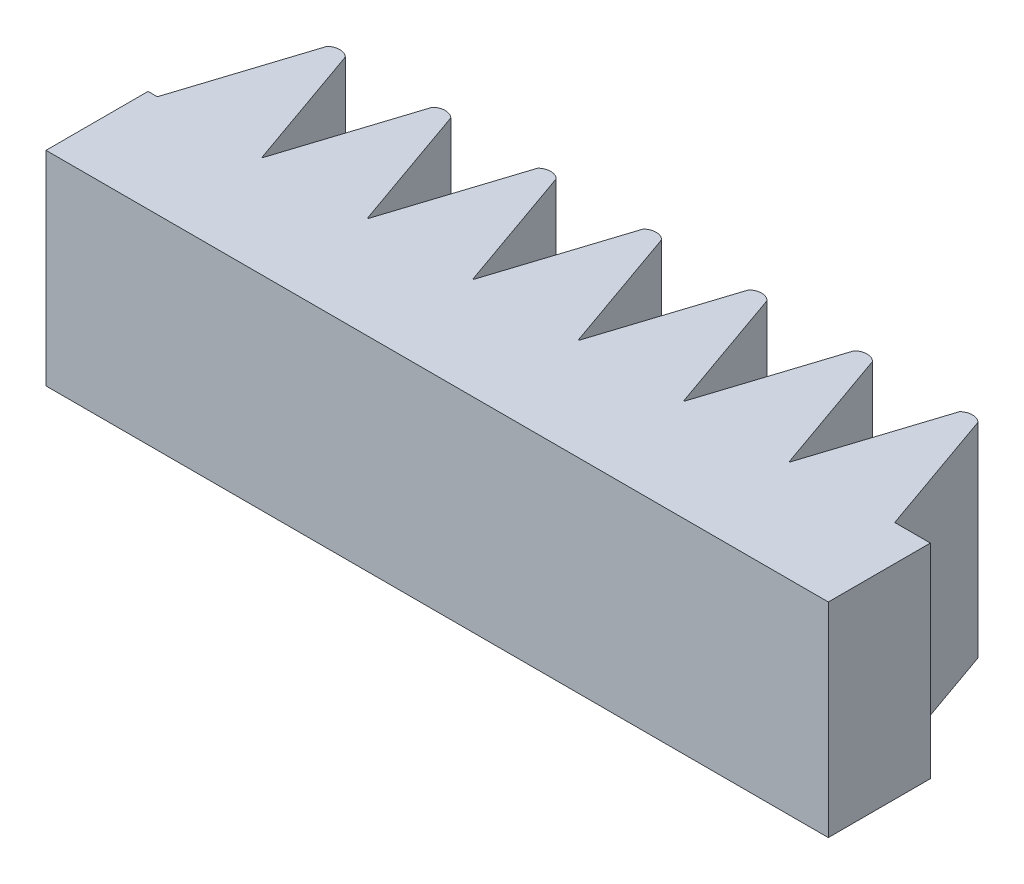
from build123d import *

# Parameters (mm, degrees)
BOSS_EXTRUDE1_DEPTH   = 6
BOSS_EXTRUDE1_2_DEPTH = 6
BOSS_EXTRUDE1_3_DEPTH = 6
BOSS_EXTRUDE1_4_DEPTH = 6
BOSS_EXTRUDE1_5_DEPTH = 6
BOSS_EXTRUDE1_6_DEPTH = 6
BOSS_EXTRUDE1_7_DEPTH = 6
BASE_W                = 23
BASE_H                = 3
BOSS_EXTRUDE2_DEPTH   = 6


with BuildPart() as part:
    # Gears-1 → Boss-Extrude1 (new body)
    with BuildSketch(Plane(origin=(0, 0, 0), x_dir=(1, 0, 0), z_dir=(0, 1, 0))):
        with BuildLine():
            Line((-0.500594601, 0), (0.709644096, 3.775809937))
            ThreePointArc((0.709644096, 3.775809937), (0.980506814, 3.882987586), (1.251369531, 3.775809937))
            Line((1.251369531, 3.775809937), (2.579049224, 0))
            Line((2.579049224, 0), (-0.500594601, 0))
        make_face()
    extrude(amount=BOSS_EXTRUDE1_DEPTH)



with BuildPart() as body_2:
    # Gears-1 → Boss-Extrude1 2 (new body)
    with BuildSketch(Plane(origin=(0, 0, 0), x_dir=(1, 0, 0), z_dir=(0, 1, 0))):
        with BuildLine():
            Line((2.599405399, 0), (5.679049224, 0))
            Line((5.679049224, 0), (4.351369531, 3.775809937))
            ThreePointArc((4.351369531, 3.775809937), (4.080506814, 3.882987586), (3.809644096, 3.775809937))
            Line((3.809644096, 3.775809937), (2.599405399, 0))
        make_face()
    extrude(amount=BOSS_EXTRUDE1_2_DEPTH)


with BuildPart() as body_3:
    # Gears-1 → Boss-Extrude1 3 (new body)
    with BuildSketch(Plane(origin=(0, 0, 0), x_dir=(1, 0, 0), z_dir=(0, 1, 0))):
        with BuildLine():
            Line((5.699405399, 0), (8.779049224, 0))
            Line((8.779049224, 0), (7.451369531, 3.775809937))
            ThreePointArc((7.451369531, 3.775809937), (7.180506814, 3.882987586), (6.909644096, 3.775809937))
            Line((6.909644096, 3.775809937), (5.699405399, 0))
        make_face()
    extrude(amount=BOSS_EXTRUDE1_3_DEPTH)


with BuildPart() as body_4:
    # Gears-1 → Boss-Extrude1 4 (new body)
    with BuildSketch(Plane(origin=(0, 0, 0), x_dir=(1, 0, 0), z_dir=(0, 1, 0))):
        with BuildLine():
            Line((8.799405399, 0), (11.879049224, 0))
            Line((11.879049224, 0), (10.551369531, 3.775809937))
            ThreePointArc((10.551369531, 3.775809937), (10.280506814, 3.882987586), (10.009644096, 3.775809937))
            Line((10.009644096, 3.775809937), (8.799405399, 0))
        make_face()
    extrude(amount=BOSS_EXTRUDE1_4_DEPTH)


with BuildPart() as body_5:
    # Gears-1 → Boss-Extrude1 5 (new body)
    with BuildSketch(Plane(origin=(0, 0, 0), x_dir=(1, 0, 0), z_dir=(0, 1, 0))):
        with BuildLine():
            Line((11.899405399, 0), (14.979049224, 0))
            Line((14.979049224, 0), (13.651369531, 3.775809937))
            ThreePointArc((13.651369531, 3.775809937), (13.380506814, 3.882987586), (13.109644096, 3.775809937))
            Line((13.109644096, 3.775809937), (11.899405399, 0))
        make_face()
    extrude(amount=BOSS_EXTRUDE1_5_DEPTH)


with BuildPart() as body_6:
    # Gears-1 → Boss-Extrude1 6 (new body)
    with BuildSketch(Plane(origin=(0, 0, 0), x_dir=(1, 0, 0), z_dir=(0, 1, 0))):
        with BuildLine():
            Line((14.999405399, 0), (18.079049224, 0))
            Line((18.079049224, 0), (16.751369531, 3.775809937))
            ThreePointArc((16.751369531, 3.775809937), (16.480506814, 3.882987586), (16.209644096, 3.775809937))
            Line((16.209644096, 3.775809937), (14.999405399, 0))
        make_face()
    extrude(amount=BOSS_EXTRUDE1_6_DEPTH)


with BuildPart() as body_7:
    # Gears-1 → Boss-Extrude1 7 (new body)
    with BuildSketch(Plane(origin=(0, 0, 0), x_dir=(1, 0, 0), z_dir=(0, 1, 0))):
        with BuildLine():
            Line((18.099405399, 0), (21.179049224, 0))
            Line((21.179049224, 0), (19.851369531, 3.775809937))
            ThreePointArc((19.851369531, 3.775809937), (19.580506814, 3.882987586), (19.309644096, 3.775809937))
            Line((19.309644096, 3.775809937), (18.099405399, 0))
        make_face()
    extrude(amount=BOSS_EXTRUDE1_7_DEPTH)


with BuildPart() as part_1:
    add(part.part)

    add(body_2.part)  # Boss-Extrude2 merges body 2

    add(body_3.part)  # Boss-Extrude2 merges body 3

    add(body_4.part)  # Boss-Extrude2 merges body 4

    add(body_5.part)  # Boss-Extrude2 merges body 5

    add(body_6.part)  # Boss-Extrude2 merges body 6

    add(body_7.part)  # Boss-Extrude2 merges body 7
    # Base → Boss-Extrude2 (add)
    with BuildSketch(Plane(origin=(0, 0, 0), x_dir=(1, 0, 0), z_dir=(0, 1, 0))):
        with Locations((10.726532056, -1.5)):
            Rectangle(BASE_W, BASE_H)
    extrude(amount=BOSS_EXTRUDE2_DEPTH)


solid = part_1.part
